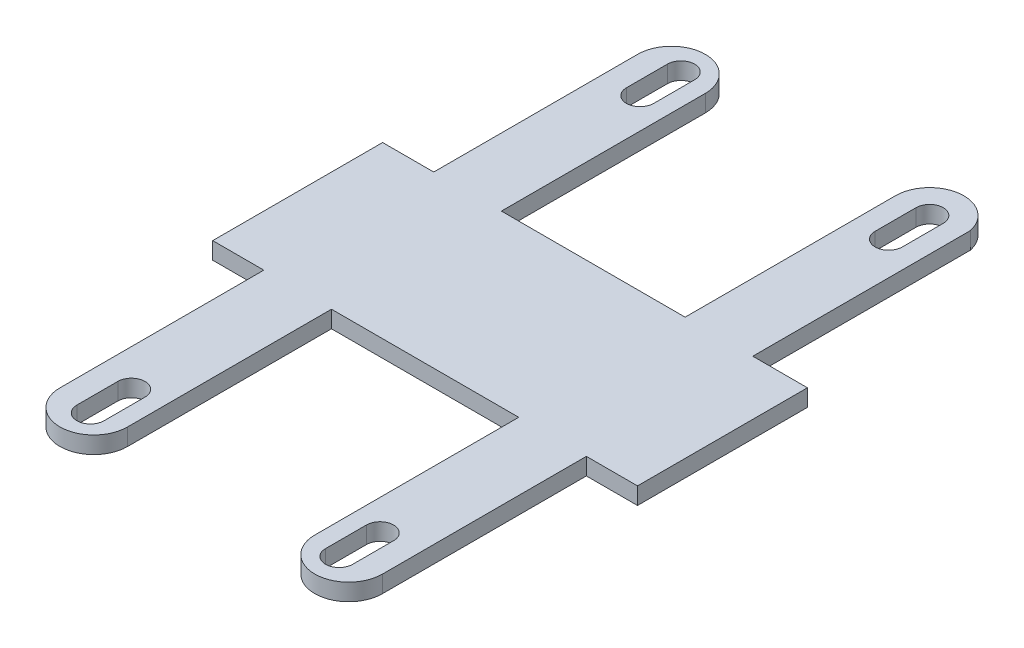
from build123d import *

# Parameters (mm, degrees)
BOSS_EXTRUDE1_DEPTH = 2


with BuildPart() as part:
    # Sketch1 → Boss-Extrude1 (new body)
    with BuildSketch(Plane(origin=(0, 0, 0), x_dir=(1, 0, 0), z_dir=(0, 1, 0))):
        with BuildLine():
            Line((21.222536541, 23.944853118), (27.654466335, 23.944853118))
            Line((27.654466335, 23.944853118), (27.654466335, 3.944853118))
            Line((27.654466335, 3.944853118), (21.63635663, 3.944853118))
            Line((21.63635663, 3.944853118), (21.63635663, -20.053586801))
            ThreePointArc((21.63635663, -20.053586801), (17.654466335, -24.035477095), (13.672576041, -20.053586801))
            Line((13.672576041, -20.053586801), (13.672576041, 3.944853118))
            Line((13.672576041, 3.944853118), (-8.36364337, 3.944853118))
            Line((-8.36364337, 3.944853118), (-8.36364337, -20.053586801))
            ThreePointArc((-8.36364337, -20.053586801), (-12.345533665, -24.035477095), (-16.327423959, -20.053586801))
            Line((-16.327423959, -20.053586801), (-16.327423959, 3.944853118))
            Line((-16.327423959, 3.944853118), (-22.345533665, 3.944853118))
            Line((-22.345533665, 3.944853118), (-22.345533665, 23.944853118))
            Line((-22.345533665, 23.944853118), (-16.327423959, 23.944853118))
            Line((-16.327423959, 23.944853118), (-16.327423959, 47.943293037))
            ThreePointArc((-16.327423959, 47.943293037), (-12.345533665, 51.925183331), (-8.36364337, 47.943293037))
            Line((-8.36364337, 47.943293037), (-8.36364337, 23.944853118))
            Line((-8.36364337, 23.944853118), (13.258755952, 23.944853118))
            Line((13.258755952, 23.944853118), (13.258755952, 48.696875563))
            ThreePointArc((13.258755952, 48.696875563), (16.856879204, 52.701609607), (21.222536541, 49.551145876))
            Line((21.222536541, 49.551145876), (21.222536541, 23.944853118))
        make_face()
        with BuildLine():
            Line((18.886464797, 48.696875563), (18.886464797, 43.880260364))
            ThreePointArc((18.886464797, 43.880260364), (17.286464797, 42.280260364), (15.686464797, 43.880260364))
            Line((15.686464797, 43.880260364), (15.686464797, 48.696875563))
            ThreePointArc((15.686464797, 48.696875563), (17.286464797, 50.296875563), (18.886464797, 48.696875563))
        make_face(mode=Mode.SUBTRACT)
        with BuildLine():
            Line((-13.577532127, 48.696875563), (-13.577532127, 43.880260364))
            ThreePointArc((-13.577532127, 43.880260364), (-11.977532127, 42.280260364), (-10.377532127, 43.880260364))
            Line((-10.377532127, 43.880260364), (-10.377532127, 48.696875563))
            ThreePointArc((-10.377532127, 48.696875563), (-11.977532127, 50.296875563), (-13.577532127, 48.696875563))
        make_face(mode=Mode.SUBTRACT)
        with BuildLine():
            Line((-13.577532127, -20.807169327), (-13.577532127, -15.990554128))
            ThreePointArc((-13.577532127, -15.990554128), (-11.977532127, -14.390554128), (-10.377532127, -15.990554128))
            Line((-10.377532127, -15.990554128), (-10.377532127, -20.807169327))
            ThreePointArc((-10.377532127, -20.807169327), (-11.977532127, -22.407169327), (-13.577532127, -20.807169327))
        make_face(mode=Mode.SUBTRACT)
        with BuildLine():
            Line((18.886464797, -20.807169327), (18.886464797, -15.990554128))
            ThreePointArc((18.886464797, -15.990554128), (17.286464797, -14.390554128), (15.686464797, -15.990554128))
            Line((15.686464797, -15.990554128), (15.686464797, -20.807169327))
            ThreePointArc((15.686464797, -20.807169327), (17.286464797, -22.407169327), (18.886464797, -20.807169327))
        make_face(mode=Mode.SUBTRACT)
    extrude(amount=BOSS_EXTRUDE1_DEPTH)


solid = part.part
